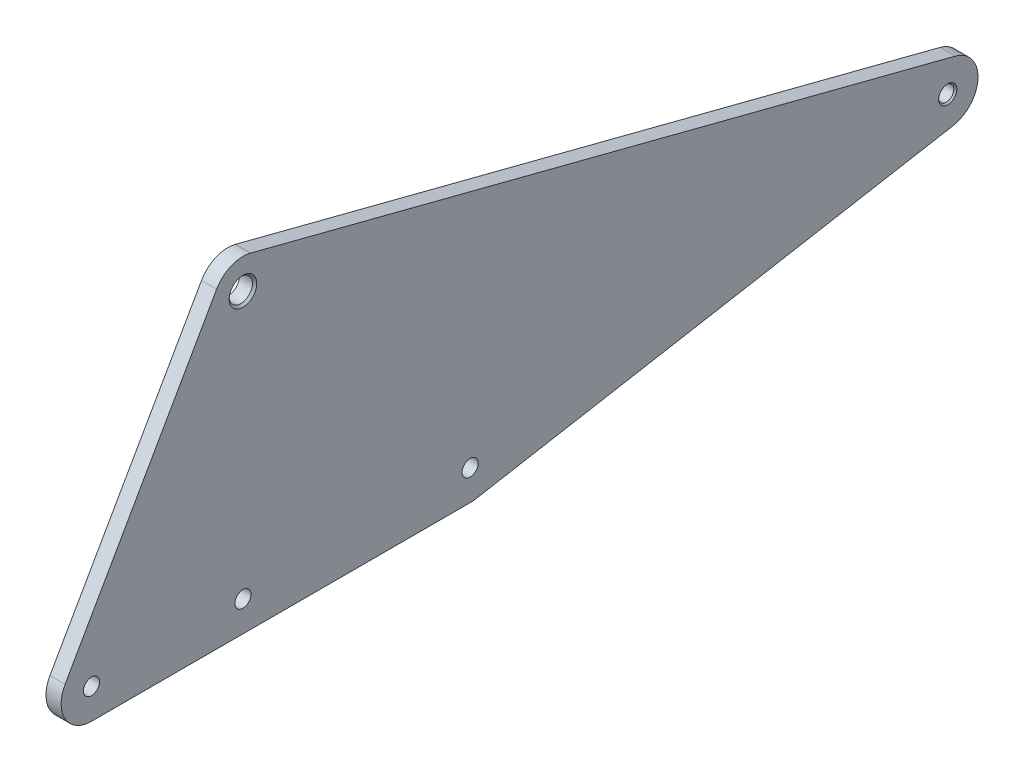
from build123d import *

# Parameters (mm, degrees)
BOSS_EXTRUDE1_DEPTH                  = 6.35
CUT_EXTRUDE1_REACH                   = 334.304
SKETCH2_R                            = 3.3782
F_3_8_CLEARANCE_HOLE1_D              = 9.8044
F_3_8_CLEARANCE_HOLE1_CSINK_D        = 11.58748
F_3_8_CLEARANCE_HOLE1_CSINK_ANGLE    = 90
F_1_4_0_2500_DOWEL_HOLE1_D           = 6.35
F_1_4_0_2500_DOWEL_HOLE1_CSINK_D     = 7.62
F_1_4_0_2500_DOWEL_HOLE1_CSINK_ANGLE = 90


with BuildPart() as part:
    # Sketch1 → Boss-Extrude1 (new body)
    with BuildSketch(Plane(origin=(0, 0, 0), x_dir=(0, 0, -1), z_dir=(1, 0, 0))):
        with BuildLine():
            Line((-74.539032088, -105.353687095), (-11.039032088, 6.279312905))
            ThreePointArc((-11.039032088, 6.279312905), (-4.952410831, 11.694598196), (3.17217164, 12.297452057))
            Line((3.17217164, 12.297452057), (298.57417164, -63.902547943))
            ThreePointArc((298.57417164, -63.902547943), (308.092531314, -76.690321285), (297.615863427, -88.705551116))
            Line((297.615863427, -88.705551116), (97.463863427, -124.138551116))
            ThreePointArc((97.463863427, -124.138551116), (96.361193237, -124.284294384), (95.25, -124.333))
            Line((95.25, -124.333), (-63.5, -124.333))
            ThreePointArc((-63.5, -124.333), (-74.478098057, -118.018245731), (-74.539032088, -105.353687095))
        make_face()
    extrude(amount=BOSS_EXTRUDE1_DEPTH)

    # Sketch2 → Cut-Extrude1 (cut, up to next)
    with BuildSketch(Plane(origin=(6.35, 0, 0), x_dir=(0, 0, -1), z_dir=(1, 0, 0)), mode=Mode.PRIVATE) as cut_extrude1_sk1:
        with Locations((-63.5, -111.633)):
            Circle(SKETCH2_R)
    cut_extrude1_tool1 = extrude(cut_extrude1_sk1.sketch, amount=-CUT_EXTRUDE1_REACH, mode=Mode.PRIVATE) & part.part
    # Sketch2 → Cut-Extrude1 (cut, up to next)
    with BuildSketch(Plane(origin=(6.35, 0, 0), x_dir=(0, 0, -1), z_dir=(1, 0, 0)), mode=Mode.PRIVATE) as cut_extrude1_sk2:
        with Locations((0, -111.633)):
            Circle(SKETCH2_R)
    cut_extrude1_tool2 = extrude(cut_extrude1_sk2.sketch, amount=-CUT_EXTRUDE1_REACH, mode=Mode.PRIVATE) & part.part
    # Sketch2 → Cut-Extrude1 (cut, up to next)
    with BuildSketch(Plane(origin=(6.35, 0, 0), x_dir=(0, 0, -1), z_dir=(1, 0, 0)), mode=Mode.PRIVATE) as cut_extrude1_sk3:
        with Locations((95.25, -111.633)):
            Circle(SKETCH2_R)
    cut_extrude1_tool3 = extrude(cut_extrude1_sk3.sketch, amount=-CUT_EXTRUDE1_REACH, mode=Mode.PRIVATE) & part.part
    add(cut_extrude1_tool1.solids().sort_by_distance((6.35, -111.633, 63.5))[0], mode=Mode.SUBTRACT)
    add(cut_extrude1_tool2.solids().sort_by_distance((6.35, -111.633, 0))[0], mode=Mode.SUBTRACT)
    add(cut_extrude1_tool3.solids().sort_by_distance((6.35, -111.633, -95.25))[0], mode=Mode.SUBTRACT)

    # 3/8 Clearance Hole1 (through all)
    with Locations(Plane(origin=(6.35, 0, 0), x_dir=(0, 0, -1), z_dir=(1, 0, 0))):
        with Locations((0, 0)):
            CounterSinkHole(F_3_8_CLEARANCE_HOLE1_D / 2, F_3_8_CLEARANCE_HOLE1_CSINK_D / 2, counter_sink_angle=F_3_8_CLEARANCE_HOLE1_CSINK_ANGLE)

    # 1/4 (0.2500) Dowel Hole1 (through all)
    with Locations(Plane(origin=(6.35, 0, 0), x_dir=(0, 0, -1), z_dir=(1, 0, 0))):
        with Locations((295.402, -76.2)):
            CounterSinkHole(F_1_4_0_2500_DOWEL_HOLE1_D / 2, F_1_4_0_2500_DOWEL_HOLE1_CSINK_D / 2, counter_sink_angle=F_1_4_0_2500_DOWEL_HOLE1_CSINK_ANGLE)


solid = part.part
